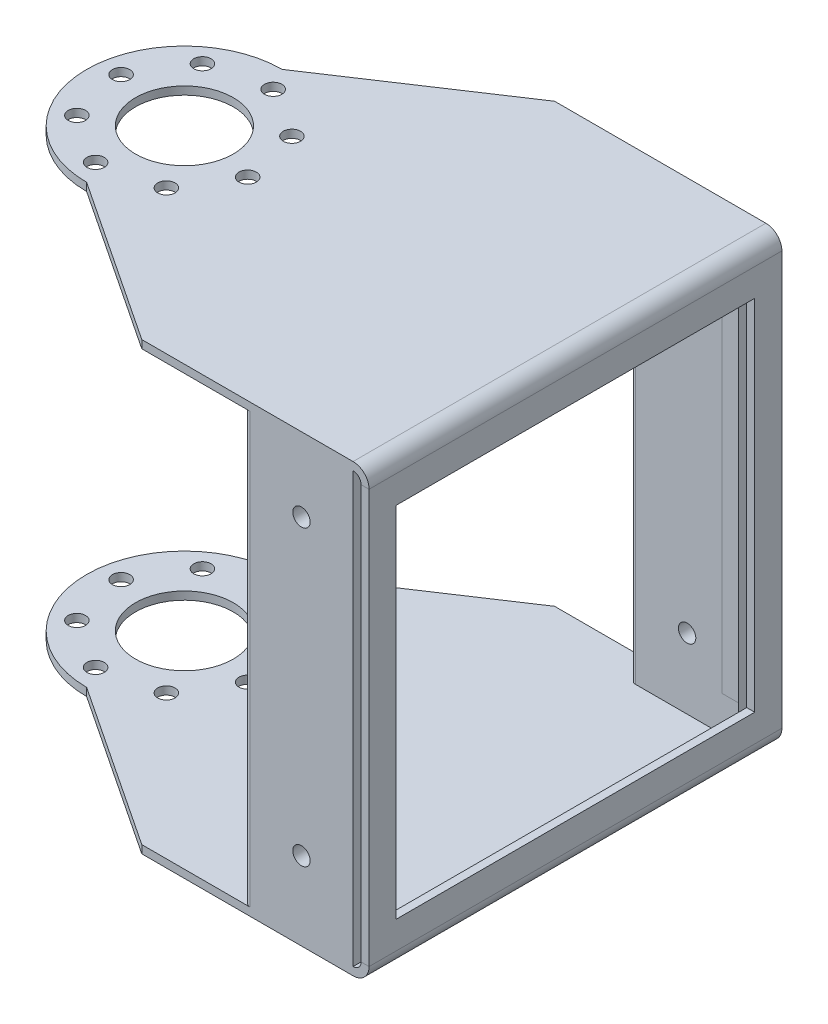
from build123d import *

# Parameters (mm, degrees)
T_LE_DE_BASE_PLI_E1_DEPTH = 38
CONG_1_R                  = 1
BOSS_EXTRU_1_REACH        = 77
ESQUISSE7_W               = 10
ESQUISSE7_H               = 2.5
CONG_2_R                  = 0.5
ESQUISSE9_W               = 33
ESQUISSE9_H               = 33
ENL_V_MAT_EXTRU_6_DEPTH   = 3
ESQUISSE11_R              = 0.8
ENL_V_MAT_EXTRU_3_DEPTH   = 76
ESQUISSE12_R              = 4.5
ENL_V_MAT_EXTRU_5_DEPTH   = 76
ESQUISSE14_R              = 0.8
ENL_V_MAT_EXTRU_7_DEPTH   = 76


# Sheet-metal steps are written as plain solids
with BuildPart() as part:
    # Esquisse1 → Tôle de base pliée1 (new body)
    with BuildSketch(Plane.XY):
        with BuildLine():
            Line((-50, 41), (-1.4732, 41))
            ThreePointArc((-1.4732, 41), (-0.43149029, 40.56850971), (0, 39.5268))
            Line((0, 39.5268), (0, 1.4732))
            ThreePointArc((0, 1.4732), (-0.43149029, 0.43149029), (-1.4732, 0))
            Line((-1.4732, 0), (-50, 0))
            Line((-50, 0), (-50, 0.7366))
            Line((-50, 0.7366), (-1.4732, 0.7366))
            ThreePointArc((-1.4732, 0.7366), (-0.952345145, 0.952345145), (-0.7366, 1.4732))
            Line((-0.7366, 1.4732), (-0.7366, 39.5268))
            ThreePointArc((-0.7366, 39.5268), (-0.952345145, 40.047654855), (-1.4732, 40.2634))
            Line((-1.4732, 40.2634), (-50, 40.2634))
            Line((-50, 40.2634), (-50, 41))
        make_face()
    extrude(amount=T_LE_DE_BASE_PLI_E1_DEPTH)

    # Congé1
    cong_1_edges = [part.edges().sort_by_distance(p)[0] for p in [
        (-50, 40.6317, 0),
        (-50, 0.3683, 0),
        (-50, 40.6317, 38),
        (-50, 0.3683, 38),
    ]]
    fillet(cong_1_edges, radius=CONG_1_R)

    # Esquisse7 → Boss.-Extru.1 (add, up to next)
    with BuildSketch(Plane(origin=(0, 41, 0), x_dir=(1, 0, 0), z_dir=(0, 1, 0)), mode=Mode.PRIVATE) as boss_extru_1_sk1:
        with Locations((-6.4732, -1.25)):
            Rectangle(ESQUISSE7_W, ESQUISSE7_H)
    boss_extru_1_tool1 = extrude(boss_extru_1_sk1.sketch, amount=-BOSS_EXTRU_1_REACH, mode=Mode.PRIVATE) - part.part
    # Esquisse7 → Boss.-Extru.1 (add, up to next)
    with BuildSketch(Plane(origin=(0, 41, 0), x_dir=(1, 0, 0), z_dir=(0, 1, 0)), mode=Mode.PRIVATE) as boss_extru_1_sk2:
        with Locations((-6.4732, -36.75)):
            Rectangle(ESQUISSE7_W, ESQUISSE7_H)
    boss_extru_1_tool2 = extrude(boss_extru_1_sk2.sketch, amount=-BOSS_EXTRU_1_REACH, mode=Mode.PRIVATE) - part.part
    add(boss_extru_1_tool1.solids().sort_by_distance((-6.4732, 41, 1.25))[0])
    add(boss_extru_1_tool2.solids().sort_by_distance((-6.4732, 41, 36.75))[0])

    # Congé2
    cong_2_edges = [part.edges().sort_by_distance(p)[0] for p in [
        (-11.4732, 20.5, 0),
        (-11.4732, 20.5, 2.5),
        (-11.4732, 20.5, 35.5),
        (-11.4732, 20.5, 38),
    ]]
    fillet(cong_2_edges, radius=CONG_2_R)

    # Esquisse9 → Enlèv. mat.-Extru.6 (cut)
    with BuildSketch(Plane(origin=(0, 0, 0), x_dir=(0, 0, -1), z_dir=(1, 0, 0))):
        with Locations((-19, 20.5)):
            Rectangle(ESQUISSE9_W, ESQUISSE9_H)
    extrude(amount=-ENL_V_MAT_EXTRU_6_DEPTH, mode=Mode.SUBTRACT)

    # Esquisse11 → Enlèv. mat.-Extru.3 (cut, through all)
    with BuildSketch(Plane.XY.offset(38)):
        with Locations((-6.2232, 34.2)):
            Circle(ESQUISSE11_R)
        with Locations((-6.2232, 7.2)):
            Circle(ESQUISSE11_R)
    extrude(amount=-ENL_V_MAT_EXTRU_3_DEPTH, mode=Mode.SUBTRACT)

    # Esquisse12 → Enlèv. mat.-Extru.5 (cut, through all)
    with BuildSketch(Plane.XZ):
        with Locations((-36, 19)):
            Circle(ESQUISSE12_R)
    extrude(amount=-ENL_V_MAT_EXTRU_5_DEPTH, mode=Mode.SUBTRACT)

    # Esquisse14 → Enlèv. mat.-Extru.7 (cut, through all)
    with BuildSketch(Plane.XZ):
        with BuildLine():
            ThreePointArc((-36, 10), (-45, 19), (-36, 28))
            Line((-36, 28), (-20.921425014, 38))
            Line((-20.921425014, 38), (-49, 38))
            ThreePointArc((-49, 38), (-49.707106781, 37.707106781), (-50, 37))
            Line((-50, 37), (-50, 1))
            ThreePointArc((-50, 1), (-49.707106781, 0.292893219), (-49, 0))
            Line((-49, 0), (-20.921425014, 0))
            Line((-20.921425014, 0), (-36, 10))
        make_face()
        with Locations((-37.174370408, 26)):
            Circle(ESQUISSE14_R)
        with Locations((-41.780152747, 23.119342189)):
            Circle(ESQUISSE14_R)
        with Locations((-43, 17.825629592)):
            Circle(ESQUISSE14_R)
        with Locations((-40.119342189, 13.219847253)):
            Circle(ESQUISSE14_R)
        with Locations((-34.825629592, 12)):
            Circle(ESQUISSE14_R)
        with Locations((-30.219847253, 14.880657811)):
            Circle(ESQUISSE14_R)
        with Locations((-29, 20.174370408)):
            Circle(ESQUISSE14_R)
        with Locations((-31.880657811, 24.780152747)):
            Circle(ESQUISSE14_R)
    extrude(amount=-ENL_V_MAT_EXTRU_7_DEPTH, mode=Mode.SUBTRACT)


solid = part.part
